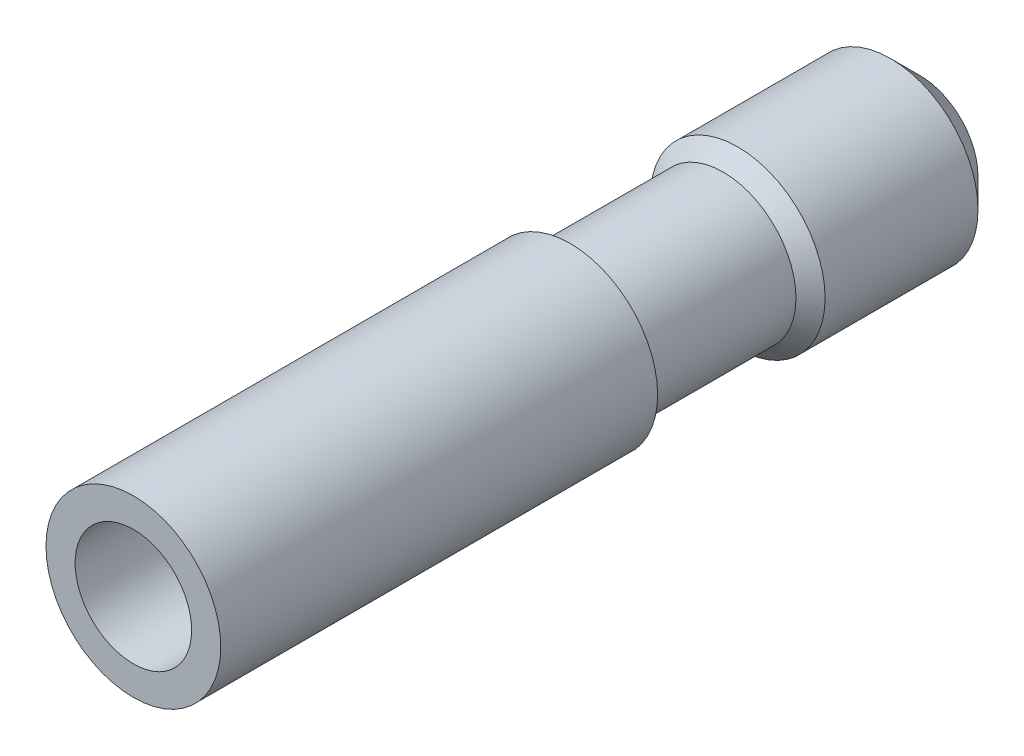
from build123d import *

# Parameters (mm, degrees)
ESQUISSE1_R                         = 3
BOSS_EXTRU_1_DEPTH                  = 27
DIAM_TRE_DU_PER_AGE_4_0_4_1_D       = 4
DIAM_TRE_DU_PER_AGE_4_0_4_1_DEPTH   = 24.5
DIAM_TRE_DU_PER_AGE_4_0_4_1_TIP     = 1.201721238
DIAM_TRE_DU_PER_AGE_2_5_2_5_2_D     = 2.5
DIAM_TRE_DU_PER_AGE_2_5_2_5_2_DEPTH = 3
DIAM_TRE_DU_PER_AGE_2_5_2_5_2_TIP   = 0.751075774
ENL_V_START                         = -15
ESQUISSE6_W                         = 11.750178357
ESQUISSE6_H                         = 11.384595502
ESQUISSE6_R                         = 2.5
ENL_V_MAT_EXTRU_1_DEPTH             = 6
CHANFREIN1_SIZE                     = 1
CHANFREIN2_SIZE                     = 0.75


with BuildPart() as part:
    # Esquisse1 → Boss.-Extru.1 (new body)
    with BuildSketch(Plane.XY):
        Circle(ESQUISSE1_R)
    extrude(amount=BOSS_EXTRU_1_DEPTH)

    # Diamètre du perçage Ø4.0 (4)1
    with Locations(Plane.XY.offset(27)):
        with Locations((0, 0)):
            Hole(DIAM_TRE_DU_PER_AGE_4_0_4_1_D / 2, depth=DIAM_TRE_DU_PER_AGE_4_0_4_1_DEPTH)
            with Locations((0, 0, -(DIAM_TRE_DU_PER_AGE_4_0_4_1_DEPTH + DIAM_TRE_DU_PER_AGE_4_0_4_1_TIP / 2))):  # 118° drill point
                Cone(0, DIAM_TRE_DU_PER_AGE_4_0_4_1_D / 2, DIAM_TRE_DU_PER_AGE_4_0_4_1_TIP, mode=Mode.SUBTRACT)

    # Diamètre du perçage Ø2.5 (2.5)2
    with Locations(Plane(origin=(0, 0, 0), x_dir=(-1, 0, 0), z_dir=(0, 0, -1))):
        with Locations((0, 0)):
            Hole(DIAM_TRE_DU_PER_AGE_2_5_2_5_2_D / 2, depth=DIAM_TRE_DU_PER_AGE_2_5_2_5_2_DEPTH)
            with Locations((0, 0, -(DIAM_TRE_DU_PER_AGE_2_5_2_5_2_DEPTH + DIAM_TRE_DU_PER_AGE_2_5_2_5_2_TIP / 2))):  # 118° drill point
                Cone(0, DIAM_TRE_DU_PER_AGE_2_5_2_5_2_D / 2, DIAM_TRE_DU_PER_AGE_2_5_2_5_2_TIP, mode=Mode.SUBTRACT)

    # Esquisse6 → Enlèv. mat.-Extru.1 (cut)
    with BuildSketch(Plane.XY.offset(27).offset(ENL_V_START)):
        with Locations((-0.219764127, 0.428836611)):
            Rectangle(ESQUISSE6_W, ESQUISSE6_H)
        Circle(ESQUISSE6_R, mode=Mode.SUBTRACT)
    extrude(amount=-ENL_V_MAT_EXTRU_1_DEPTH, mode=Mode.SUBTRACT)

    # Chanfrein1
    chanfrein1_edges = [part.edges().sort_by_distance(p)[0] for p in [
        (-3, 0, 0),
    ]]
    chamfer(chanfrein1_edges, length=CHANFREIN1_SIZE)

    # Chanfrein2
    # the kernel refuses this chamfer: 0.75 mm, written as the material it adds along each edge
    with BuildSketch(Plane(origin=(0, 0, 6), x_dir=(1, 0, 0), z_dir=(0, -1, 0))) as chanfrein2_piece_1_section:
        Polygon((2.5 + CHANFREIN2_SIZE, 0), (2.5, CHANFREIN2_SIZE), (2.5, 0), align=None)
    chanfrein2_piece_1 = revolve(axis=Axis((0, 0, 6), (0, 0, 1)), mode=Mode.PRIVATE)
    chanfrein2_piece_1 = chanfrein2_piece_1 & Plane(origin=(0, 0, 6.498848263), x_dir=(1, 0, 0), z_dir=(0, 0, -1)) * Cylinder(3, 13, mode=Mode.PRIVATE)
    add(chanfrein2_piece_1)


solid = part.part
